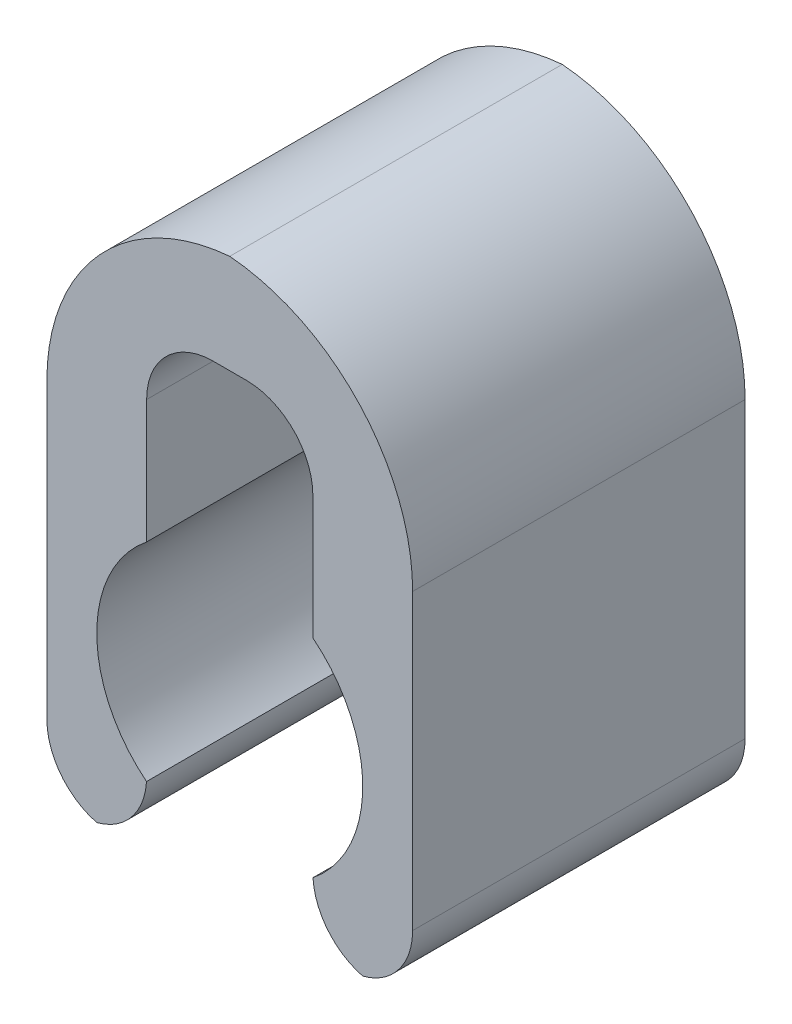
from build123d import *

# Parameters (mm, degrees)
BOSS_EXTRUDE1_DEPTH = 10
FILLET1_R           = 6
FILLET2_R           = 2
FILLET3_R           = 2
SKETCH2_R           = 4
CUT_EXTRUDE1_DEPTH  = 34.113449774


with BuildPart() as part:
    # Sketch1 → Boss-Extrude1 (new body)
    with BuildSketch(Plane.XY):
        with BuildLine():
            Line((-27.171188048, -9.347902097), (-27.171188048, -6.180932375))
            ThreePointArc((-27.171188048, -6.180932375), (-27.771188048, -4.347902097), (-27.171188048, -2.514871819))
            Line((-27.171188048, -2.514871819), (-27.171188048, 4.485128181))
            Line((-27.171188048, 4.485128181), (-22.171188048, 4.485128181))
            Line((-22.171188048, 4.485128181), (-22.171188048, -2.514871819))
            ThreePointArc((-22.171188048, -2.514871819), (-21.725004076, -3.38353702), (-21.571188048, -4.347902097))
            ThreePointArc((-21.571188048, -4.347902097), (-21.725004076, -5.312267173), (-22.171188048, -6.180932375))
            Line((-22.171188048, -6.180932375), (-22.171188048, -9.347902097))
            Line((-22.171188048, -9.347902097), (-19.171188048, -9.347902097))
            Line((-19.171188048, -9.347902097), (-19.171188048, 7.485128181))
            Line((-19.171188048, 7.485128181), (-30.171188048, 7.485128181))
            Line((-30.171188048, 7.485128181), (-30.171188048, -9.347902097))
            Line((-30.171188048, -9.347902097), (-27.171188048, -9.347902097))
        make_face()
    extrude(amount=BOSS_EXTRUDE1_DEPTH)

    # Fillet1
    # the kernel refuses this fillet: 6 mm, written as the material it takes off along each edge
    with BuildSketch(Plane(origin=(-19.171188048, 7.485128181, -15), x_dir=(-1, 0, 0), z_dir=(0, 0, 1))) as fillet1_piece_1:
        with BuildLine():
            CenterArc((FILLET1_R, FILLET1_R), FILLET1_R, 180, 90)
            Line((0, FILLET1_R), (0, 0))
            Line((0, 0), (FILLET1_R, 0))
        make_face()
    extrude(amount=40, mode=Mode.SUBTRACT)
    with BuildSketch(Plane(origin=(-30.171188048, 7.485128181, -15), x_dir=(1, 0, 0), z_dir=(0, 0, 1))) as fillet1_piece_2:
        with BuildLine():
            CenterArc((FILLET1_R, -FILLET1_R), FILLET1_R, 90, 90)
            Line((0, -FILLET1_R), (0, 0))
            Line((0, 0), (FILLET1_R, 0))
        make_face()
    extrude(amount=40, mode=Mode.SUBTRACT)

    # Fillet2
    # the kernel refuses this fillet: 2 mm, written as the material it takes off along each edge
    with BuildSketch(Plane(origin=(-19.171188048, -9.347902097, -5), x_dir=(0, 1, 0), z_dir=(0, 0, 1)), Plane(origin=(-22.171188048, -9.347902097, -5), x_dir=(1, 0, 0), z_dir=(0, 0, 1)), Plane(origin=(-30.171188048, -9.347902097, -5), x_dir=(1, 0, 0), z_dir=(0, 0, 1))) as fillet2_piece_1:
        with BuildLine():
            CenterArc((FILLET2_R, FILLET2_R), FILLET2_R, 180, 90)
            Line((0, FILLET2_R), (0, 0))
            Line((0, 0), (FILLET2_R, 0))
        make_face()
    extrude(amount=20, mode=Mode.SUBTRACT)
    with BuildSketch(Plane(origin=(-27.171188048, -9.347902097, -5), x_dir=(-1, 0, 0), z_dir=(0, 0, 1))) as fillet2_piece_2:
        with BuildLine():
            CenterArc((FILLET2_R, -FILLET2_R), FILLET2_R, 90, 90)
            Line((0, -FILLET2_R), (0, 0))
            Line((0, 0), (FILLET2_R, 0))
        make_face()
    extrude(amount=20, mode=Mode.SUBTRACT)

    # Fillet3
    fillet3_edges = [part.edges().sort_by_distance(p)[0] for p in [
        (-22.171188048, 4.485128181, 5),
        (-27.171188048, 4.485128181, 5),
    ]]
    fillet(fillet3_edges, radius=FILLET3_R)

    # Sketch2 → Cut-Extrude1 (cut, through all)
    with BuildSketch(Plane.XY.offset(10)):
        with Locations((-24.671188048, -4.347902097)):
            Circle(SKETCH2_R)
    extrude(amount=-CUT_EXTRUDE1_DEPTH, mode=Mode.SUBTRACT)


solid = part.part
